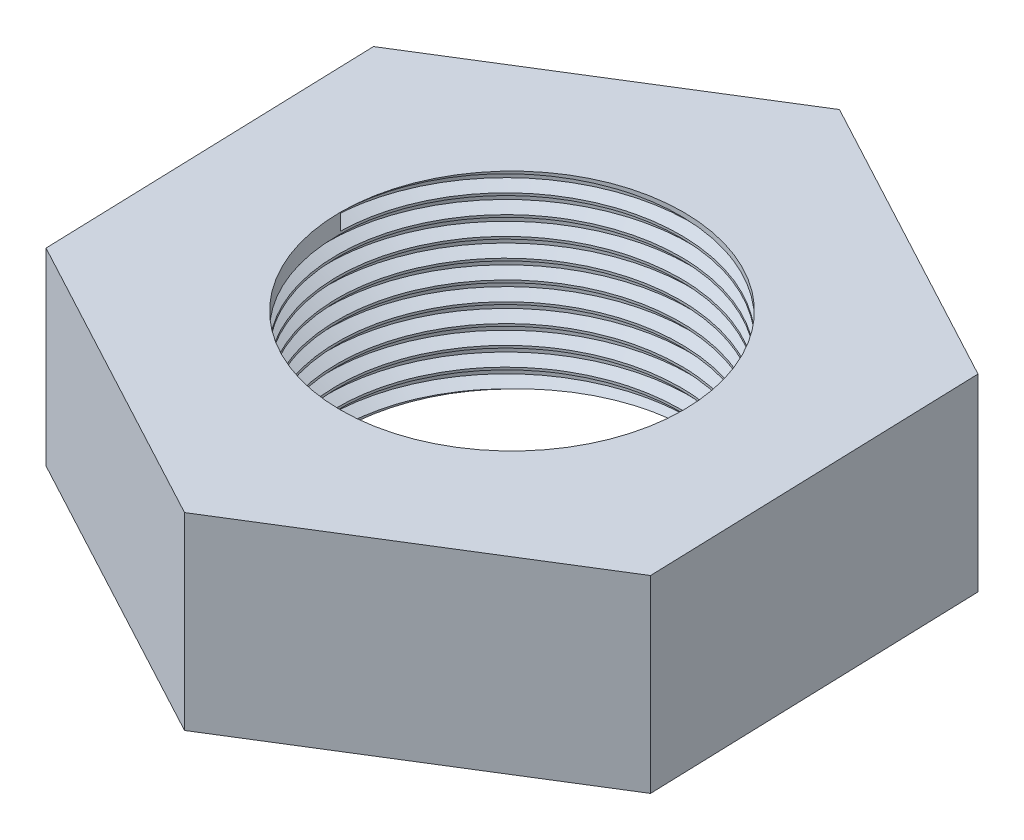
from build123d import *

# Parameters (mm, degrees)
BOSS_EXTRUDE1_DEPTH = 30
SKETCH2_R           = 27.254284909
CUT_EXTRUDE1_DEPTH  = 30
THREAD1_PITCH       = 3


with BuildPart() as part:
    # Sketch1 → Boss-Extrude1 (new body)
    with BuildSketch(Plane(origin=(0, 0, 0), x_dir=(1, 0, 0), z_dir=(0, 1, 0))):
        Polygon((47.423892762, -25.4), (45.708991637, 28.370295879), (-1.714901125, 53.770295879), (-47.423892762, 25.4), (-45.708991637, -28.370295879), (1.714901125, -53.770295879), align=None)
    extrude(amount=BOSS_EXTRUDE1_DEPTH)

    # Sketch2 → Cut-Extrude1 (cut)
    with BuildSketch(Plane(origin=(0, 30, 0), x_dir=(1, 0, 0), z_dir=(0, 1, 0))):
        with Locations(Location((0, 0, 0), (0, 0, 270))):
            Circle(SKETCH2_R)
    extrude(amount=-CUT_EXTRUDE1_DEPTH, mode=Mode.SUBTRACT)

    # Thread1: arcs per turn and ends read off the stored shape
    # Thread1: the profile of Thread Profile1 profile screwed along a right-hand helix through 10 turns, 10 arcs to a turn; built about Z, then put on its axis
    thread1_z = Axis((0, 0, 0), (0, 0, 1))
    thread1_corners = [(27.253984909, 0, -3.000173205), (27.253984909, 0, -0.374826803), (28.878082534, 0, -1.312500004), (28.878082534, 0, -2.062500004)]
    with BuildLine(mode=Mode.PRIVATE) as thread1_profile:
        Line(thread1_corners[0], thread1_corners[1])
        Line(thread1_corners[1], thread1_corners[2])
        Line(thread1_corners[2], thread1_corners[3])
        Line(thread1_corners[3], thread1_corners[0])
    thread1_cap = Face(thread1_profile.wire())
    thread1_turn_angles = [0, 18, 36, 54, 72, 90, 108, 126, 144, 162, 180, 198, 216, 234, 252, 270, 288, 306, 324, 342, 360]
    thread1_turn_weights = [1, 0.9510565162951535, 1, 0.9510565162951535, 1, 0.9510565162951535, 1, 0.9510565162951535, 1, 0.9510565162951535, 1, 0.9510565162951535, 1, 0.9510565162951535, 1, 0.9510565162951535, 1, 0.9510565162951535, 1, 0.9510565162951535, 1]
    thread1_turn_rails = [Edge.make_bspline([Vector(p[0], p[1], 0).rotate(thread1_z, thread1_turn_angles[k]) / thread1_turn_weights[k] + Vector(0, 0, p[2] + THREAD1_PITCH * thread1_turn_angles[k] / 360) for k in range(21)], [0, 0, 0, 1, 1, 2, 2, 3, 3, 4, 4, 5, 5, 6, 6, 7, 7, 8, 8, 9, 9, 10, 10, 10], 2, thread1_turn_weights) for p in thread1_corners]
    thread1_turn_sides = [Face.make_surface_from_curves(thread1_turn_rails[p[0]], thread1_turn_rails[p[1]]) for p in [(0, 1), (1, 2), (2, 3), (3, 0)]]
    thread1 = Plane(origin=(0, 27, 0), x_dir=(-1, 0, 0), z_dir=(0, -1, 0)) * Solid(Shell([*[p.moved(Location((0, 0, THREAD1_PITCH * i))) for i in range(10) for p in thread1_turn_sides], thread1_cap, thread1_cap.rotate(thread1_z, 3600).moved(Location((0, 0, THREAD1_PITCH * 3600 / 360)))]))
    add(thread1, mode=Mode.SUBTRACT)


solid = part.part
